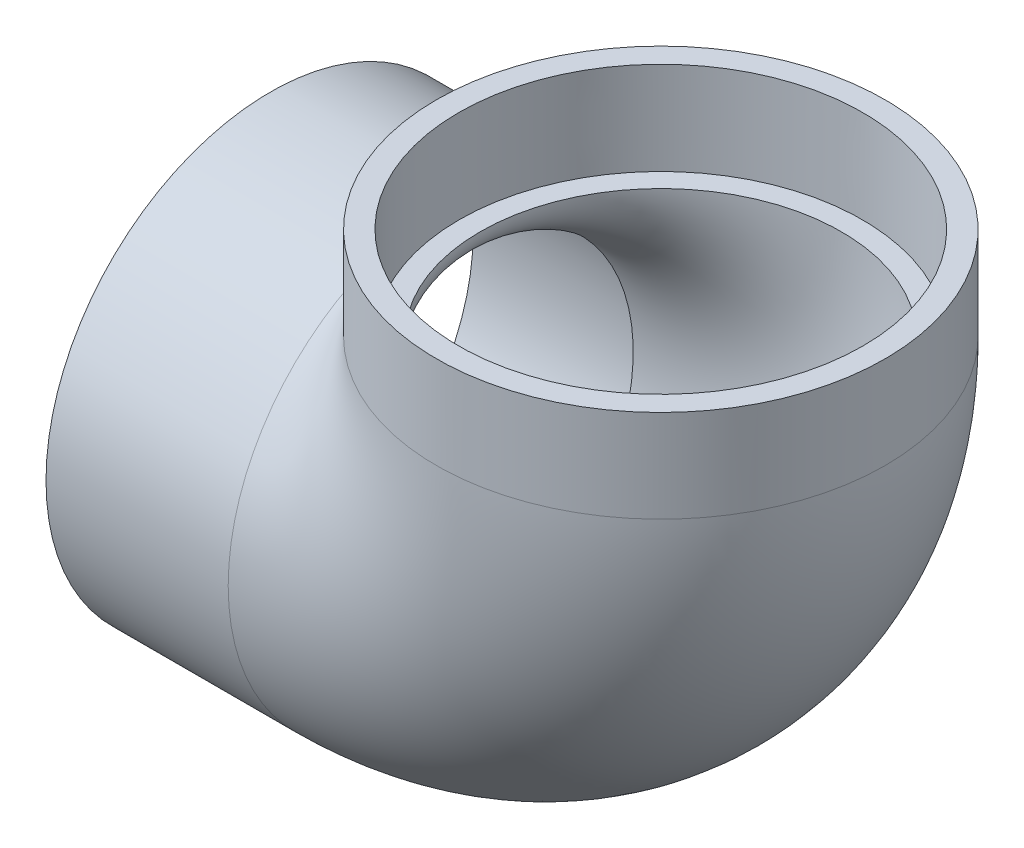
from build123d import *

# Parameters (mm, degrees)
SKETCH3_R          = 63.5
SKETCH3_R_2        = 51.1302
SKETCH5_R          = 63.5
SKETCH5_R_2        = 42.73738
CUT_EXTRUDE1_DEPTH = 25.4


with BuildPart() as part:
    # Sketch1 → Revolve1 (revolve)
    with BuildSketch(Plane.XY):
        Polygon((-110.49, -63.5), (-58.928, -63.5), (-58.928, -57.0357), (-110.49, -57.3786), align=None)
    revolve(axis=Axis((-110.49, 0, 0), (1, 0, 0)))


with BuildPart() as body_2:
    # Sketch2 → Revolve2 (revolve)
    with BuildSketch(Plane.XY):
        Polygon((57.3786, 110.49), (57.0357, 58.928), (63.5, 58.928), (63.5, 110.49), align=None)
    revolve(axis=Axis((0, 0, 0), (0, 1, 0)))


with BuildPart() as sweep1_tool:
    # Sweep1: sweep along a path in Sketch4
    with BuildLine(Plane.XY) as sweep1_path:
        ThreePointArc((-58.928, 0), (-17.259612, 17.259612), (0, 58.928))
    # Sketch3 → Sweep1 (sweep)
    with BuildSketch(Plane(origin=(-58.928, 0, 0), x_dir=(0, 0, -1), z_dir=(1, 0, 0))):
        Circle(SKETCH3_R)
        Circle(SKETCH3_R_2, mode=Mode.SUBTRACT)
    sweep(path=sweep1_path.line)


with BuildPart() as part_1:
    add(part.part)


with BuildPart() as part_2:
    # Sweep1: joined with sweep1_tool
    add(part_1.part.fuse(sweep1_tool.part, body_2.part, tol=0.00001))

    # Sketch5 → Cut-Extrude1 (cut)
    with BuildSketch(Plane(origin=(0, 110.49, 0), x_dir=(1, 0, 0), z_dir=(0, 1, 0))):
        Circle(SKETCH5_R)
        Circle(SKETCH5_R_2, mode=Mode.SUBTRACT)
    extrude(amount=-CUT_EXTRUDE1_DEPTH, mode=Mode.SUBTRACT)


solid = part_2.part
